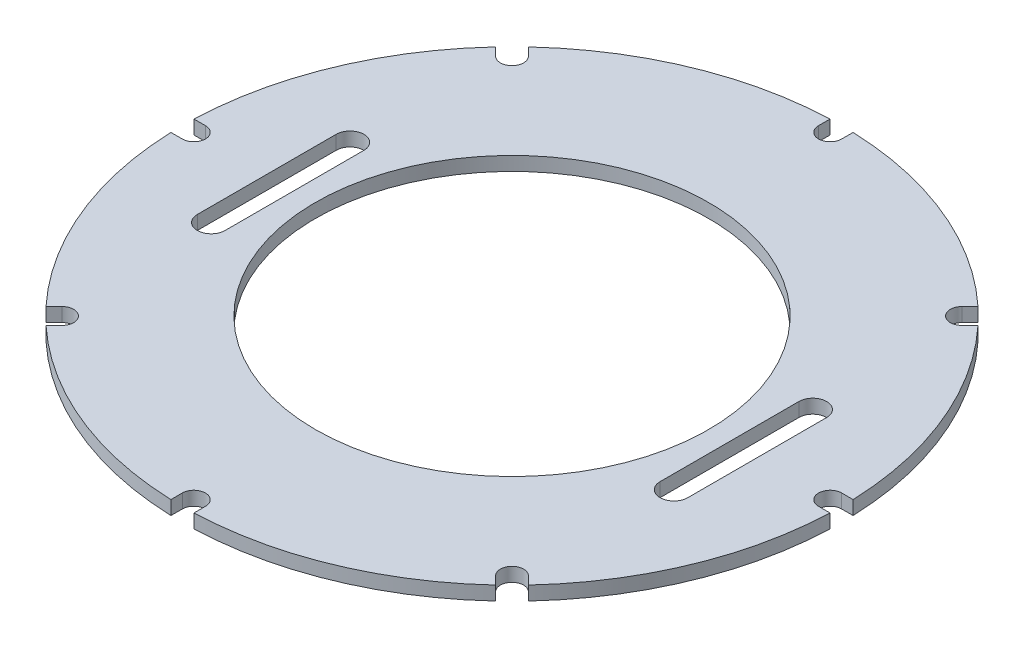
from build123d import *

# Parameters (mm, degrees)
SKETCH1_R           = 8.5
BOSS_EXTRUDE1_DEPTH = 0.6


with BuildPart() as part:
    # Sketch1 → Boss-Extrude1 (new body)
    with BuildSketch(Plane(origin=(0, 0, 0), x_dir=(1, 0, 0), z_dir=(0, 1, 0))):
        with BuildLine():
            Line((-0.5, -14.241225369), (-0.5, -13.75))
            ThreePointArc((-0.5, -13.75), (0, -13.25), (0.5, -13.75))
            Line((0.5, -13.75), (0.5, -14.241225369))
            ThreePointArc((0.5, -14.241225369), (5.453238911, -13.165283338), (9.71651364, -10.423620421))
            Line((9.71651364, -10.423620421), (9.369164851, -10.076271632))
            ThreePointArc((9.369164851, -10.076271632), (9.369164851, -9.369164851), (10.076271632, -9.369164851))
            Line((10.076271632, -9.369164851), (10.423620421, -9.71651364))
            ThreePointArc((10.423620421, -9.71651364), (13.165283338, -5.453238911), (14.241225369, -0.5))
            Line((14.241225369, -0.5), (13.75, -0.5))
            ThreePointArc((13.75, -0.5), (13.25, 0), (13.75, 0.5))
            Line((13.75, 0.5), (14.241225369, 0.5))
            ThreePointArc((14.241225369, 0.5), (13.165283338, 5.453238911), (10.423620421, 9.71651364))
            Line((10.423620421, 9.71651364), (10.076271632, 9.369164851))
            ThreePointArc((10.076271632, 9.369164851), (9.369164851, 9.369164851), (9.369164851, 10.076271632))
            Line((9.369164851, 10.076271632), (9.71651364, 10.423620421))
            ThreePointArc((9.71651364, 10.423620421), (5.453238911, 13.165283338), (0.5, 14.241225369))
            Line((0.5, 14.241225369), (0.5, 13.75))
            ThreePointArc((0.5, 13.75), (0, 13.25), (-0.5, 13.75))
            Line((-0.5, 13.75), (-0.5, 14.241225369))
            ThreePointArc((-0.5, 14.241225369), (-5.453238911, 13.165283338), (-9.71651364, 10.423620421))
            Line((-9.71651364, 10.423620421), (-9.369164851, 10.076271632))
            ThreePointArc((-9.369164851, 10.076271632), (-9.369164851, 9.369164851), (-10.076271632, 9.369164851))
            Line((-10.076271632, 9.369164851), (-10.423620421, 9.71651364))
            ThreePointArc((-10.423620421, 9.71651364), (-13.165283338, 5.453238911), (-14.241225369, 0.5))
            Line((-14.241225369, 0.5), (-13.75, 0.5))
            ThreePointArc((-13.75, 0.5), (-13.25, 0), (-13.75, -0.5))
            Line((-13.75, -0.5), (-14.241225369, -0.5))
            ThreePointArc((-14.241225369, -0.5), (-13.165283338, -5.453238911), (-10.423620421, -9.71651364))
            Line((-10.423620421, -9.71651364), (-10.076271632, -9.369164851))
            ThreePointArc((-10.076271632, -9.369164851), (-9.369164851, -9.369164851), (-9.369164851, -10.076271632))
            Line((-9.369164851, -10.076271632), (-9.71651364, -10.423620421))
            ThreePointArc((-9.71651364, -10.423620421), (-5.453238911, -13.165283338), (-0.5, -14.241225369))
        make_face()
        with BuildLine():
            Line((-9.4, 3), (-9.4, -3))
            ThreePointArc((-9.4, -3), (-10, -3.6), (-10.6, -3))
            Line((-10.6, -3), (-10.6, 3))
            ThreePointArc((-10.6, 3), (-10, 3.6), (-9.4, 3))
        make_face(mode=Mode.SUBTRACT)
        Circle(SKETCH1_R, mode=Mode.SUBTRACT)
        with BuildLine():
            ThreePointArc((10.6, -3), (10, -3.6), (9.4, -3))
            Line((9.4, -3), (9.4, 3))
            ThreePointArc((9.4, 3), (10, 3.6), (10.6, 3))
            Line((10.6, 3), (10.6, -3))
        make_face(mode=Mode.SUBTRACT)
    extrude(amount=BOSS_EXTRUDE1_DEPTH)


solid = part.part
